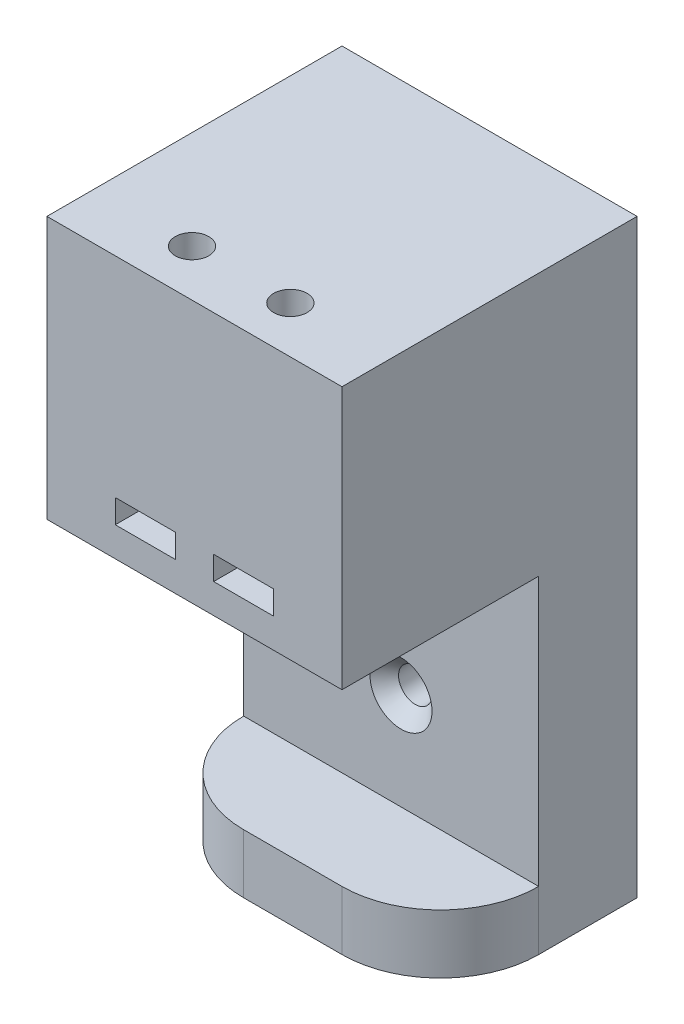
from build123d import *

# Parameters (mm, degrees)
ESQUISSE1_W                                    = 30
ESQUISSE1_H                                    = 60
BOSS_EXTRU_1_DEPTH                             = 10
ESQUISSE2_W                                    = 30
ESQUISSE2_H                                    = 6
BOSS_EXTRU_2_DEPTH                             = 10
ESQUISSE4_W                                    = 30
ESQUISSE4_H                                    = 26.68
BOSS_EXTRU_3_DEPTH                             = 20
D_GAGEMENT_M31_D                               = 3.4
D_GAGEMENT_M31_DEPTH                           = 26.68
D_GAGEMENT_M31_TIP                             = 1.021463052
FRAISAGE_POUR_VIS_T_TE_FRAIS_E_M31_D           = 3.4
FRAISAGE_POUR_VIS_T_TE_FRAIS_E_M31_DEPTH       = 10
FRAISAGE_POUR_VIS_T_TE_FRAIS_E_M31_CSINK_D     = 6.3
FRAISAGE_POUR_VIS_T_TE_FRAIS_E_M31_CSINK_ANGLE = 90
FRAISAGE_POUR_VIS_T_TE_FRAIS_E_M31_TIP         = 1.021463052
CONG_1_R                                       = 10
ESQUISSE13_W                                   = 6.1
ESQUISSE13_H                                   = 2.4
ENL_V_MAT_EXTRU_2_DEPTH                        = 8.45


with BuildPart() as part:
    # Esquisse1 → Boss.-Extru.1 (new body)
    with BuildSketch(Plane.XY):
        with Locations((15, 30)):
            Rectangle(ESQUISSE1_W, ESQUISSE1_H)
    extrude(amount=BOSS_EXTRU_1_DEPTH)

    # Esquisse2 → Boss.-Extru.2 (add)
    with BuildSketch(Plane.XY.offset(10)):
        with Locations((15, 3)):
            Rectangle(ESQUISSE2_W, ESQUISSE2_H)
    extrude(amount=BOSS_EXTRU_2_DEPTH)

    # Esquisse4 → Boss.-Extru.3 (add)
    with BuildSketch(Plane.XY.offset(10)):
        with Locations((15, 46.66)):
            Rectangle(ESQUISSE4_W, ESQUISSE4_H)
    extrude(amount=BOSS_EXTRU_3_DEPTH)

    # Dégagement M31
    with Locations(Plane(origin=(0, 33.32, 0), x_dir=(-1, 0, 0), z_dir=(0, -1, 0))):
        with Locations((-10, -25.25), (-20, -25.25)):
            Hole(D_GAGEMENT_M31_D / 2, depth=D_GAGEMENT_M31_DEPTH)
            with Locations((0, 0, -(D_GAGEMENT_M31_DEPTH + D_GAGEMENT_M31_TIP / 2))):  # 118° drill point
                Cone(0, D_GAGEMENT_M31_D / 2, D_GAGEMENT_M31_TIP, mode=Mode.SUBTRACT)

    # Fraisage pour vis à tête fraisée M31
    with Locations(Plane.XY.offset(10)):
        with Locations((10, 23.32), (16, 16)):
            CounterSinkHole(FRAISAGE_POUR_VIS_T_TE_FRAIS_E_M31_D / 2, FRAISAGE_POUR_VIS_T_TE_FRAIS_E_M31_CSINK_D / 2, depth=FRAISAGE_POUR_VIS_T_TE_FRAIS_E_M31_DEPTH, counter_sink_angle=FRAISAGE_POUR_VIS_T_TE_FRAIS_E_M31_CSINK_ANGLE)
            with Locations((0, 0, -(FRAISAGE_POUR_VIS_T_TE_FRAIS_E_M31_DEPTH + FRAISAGE_POUR_VIS_T_TE_FRAIS_E_M31_TIP / 2))):  # 118° drill point
                Cone(0, FRAISAGE_POUR_VIS_T_TE_FRAIS_E_M31_D / 2, FRAISAGE_POUR_VIS_T_TE_FRAIS_E_M31_TIP, mode=Mode.SUBTRACT)

    # Congé1
    cong_1_edges = [part.edges().sort_by_distance(p)[0] for p in [
        (30, 3, 20),
        (0, 3, 20),
    ]]
    fillet(cong_1_edges, radius=CONG_1_R)

    # Esquisse13 → Enlèv. mat.-Extru.2 (cut)
    with BuildSketch(Plane.XY.offset(30)):
        with Locations((10, 37.52)):
            Rectangle(ESQUISSE13_W, ESQUISSE13_H)
        with Locations((20, 37.52)):
            Rectangle(ESQUISSE13_W, ESQUISSE13_H)
    extrude(amount=-ENL_V_MAT_EXTRU_2_DEPTH, mode=Mode.SUBTRACT)


solid = part.part
